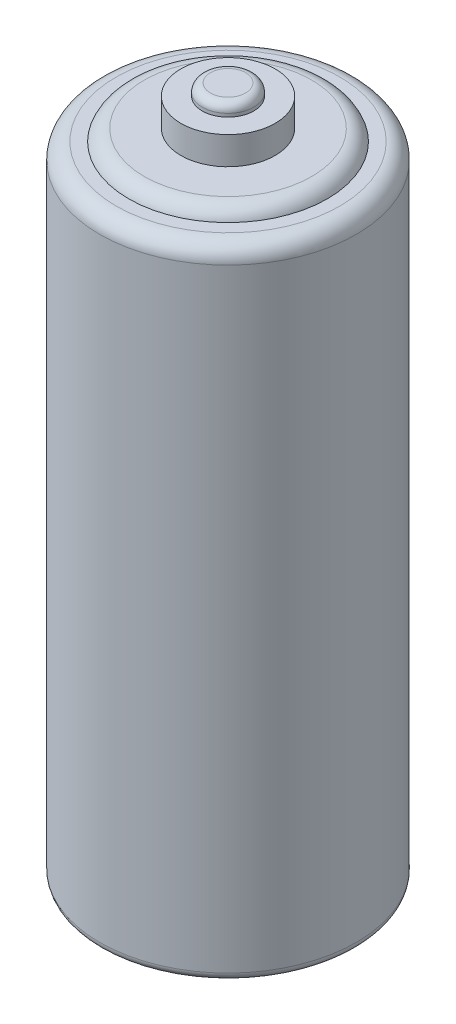
from build123d import *

# Parameters (mm, degrees)
SKETCH1_R            = 7.822299743
BOSS_EXTRUDE1_DEPTH  = 38.9
FILLET1_R            = 1
SKETCH7_R            = 6.058269956
BOSS_EXTRUDE7_DEPTH  = 0.7
FILLET5_R            = 1
SKETCH8_R            = 2.878199419
BOSS_EXTRUDE8_DEPTH  = 1.7
SKETCH9_R            = 1.57347679
BOSS_EXTRUDE9_DEPTH  = 0.7
FILLET7_R            = 0.5
SKETCH10_R           = 6.615584601
BOSS_EXTRUDE11_DEPTH = 0.2
FILLET8_R            = 0.5
FILLET9_R            = 0.5
SKETCH11_R           = 5.403530489
BOSS_EXTRUDE12_DEPTH = 0.2
FILLET10_R           = 0.5


with BuildPart() as part:
    # Sketch1 → Boss-Extrude1 (new body)
    with BuildSketch(Plane(origin=(0, 0, 0), x_dir=(1, 0, 0), z_dir=(0, 1, 0))):
        with Locations(Location((-7.367466469, 0.770235131, 0), (0, 0, 270))):
            Circle(SKETCH1_R)
    extrude(amount=BOSS_EXTRUDE1_DEPTH)

    # Fillet1
    fillet1_edges = [part.edges().sort_by_distance(p)[0] for p in [
        (-7.367466469, 38.9, -8.592534873),
    ]]
    fillet(fillet1_edges, radius=FILLET1_R)

    # Sketch7 → Boss-Extrude7 (add)
    with BuildSketch(Plane(origin=(0, 38.9, 0), x_dir=(1, 0, 0), z_dir=(0, 1, 0))):
        with Locations(Location((-7.367466469, 0.770235131, 0), (0, 0, 270))):
            Circle(SKETCH7_R)
    extrude(amount=BOSS_EXTRUDE7_DEPTH)

    # Fillet5
    # the kernel refuses this fillet: 1 mm, written as the material it takes off along each edge
    with BuildSketch(Plane(origin=(-7.367466469, 39.6, -0.770235131), x_dir=(0, 0, 1), z_dir=(-1, 0, 0))) as fillet5_piece_1:
        with BuildLine():
            CenterArc((5.104330755, -1), FILLET5_R, 17.457603124, 72.542396876)
            Line((5.104330755, 0), (5.104330755, 0.02))
            Line((5.104330755, 0.02), (6.058269956, 0.02))
            Line((6.058269956, 0.02), (6.078269956, 0))
            ThreePointArc((6.078269956, 0), (6.078269956, -0.35), (6.07734874, -0.694))
            Line((6.07734874, -0.694), (6.058269956, -0.7))
        make_face()
    revolve(axis=Axis((-7.367466469, 39.6, -0.770235131), (0, 1, 0)), mode=Mode.SUBTRACT)

    # Sketch8 → Boss-Extrude8 (add)
    with BuildSketch(Plane(origin=(0, 39.6, 0), x_dir=(1, 0, 0), z_dir=(0, 1, 0))):
        with Locations(Location((-7.367466469, 0.770235131, 0), (0, 0, 270))):
            Circle(SKETCH8_R)
    extrude(amount=BOSS_EXTRUDE8_DEPTH)

    # Sketch9 → Boss-Extrude9 (add)
    with BuildSketch(Plane(origin=(0, 41.3, 0), x_dir=(1, 0, 0), z_dir=(0, 1, 0))):
        with Locations(Location((-7.367466469, 0.770235131, 0), (0, 0, 270))):
            Circle(SKETCH9_R)
    extrude(amount=BOSS_EXTRUDE9_DEPTH)

    # Fillet7
    fillet7_edges = [part.edges().sort_by_distance(p)[0] for p in [
        (-7.367466469, 42, -2.343711921),
    ]]
    fillet(fillet7_edges, radius=FILLET7_R)

    # Sketch10 → Boss-Extrude11 (add)
    with BuildSketch(Plane.XZ):
        with Locations(Location((-7.367466469, -0.770235131, 0), (0, 0, 270))):
            Circle(SKETCH10_R)
    extrude(amount=BOSS_EXTRUDE11_DEPTH)

    # Fillet8
    fillet8_edges = [part.edges().sort_by_distance(p)[0] for p in [
        (-7.367466469, 0, -8.592534873),
    ]]
    fillet(fillet8_edges, radius=FILLET8_R)

    # Fillet9
    # the kernel refuses this fillet: 0.5 mm, written as the material it takes off along each edge
    with BuildSketch(Plane(origin=(-7.367466469, -0.2, -0.770235131), x_dir=(0, 0, -1), z_dir=(-1, 0, 0))) as fillet9_piece_1:
        with BuildLine():
            CenterArc((6.215584601, -0.5), FILLET9_R, 36.869897645, 53.130102355)
            Line((6.215584601, 0), (6.215584601, 0.01))
            Line((6.215584601, 0.01), (6.615584601, 0.01))
            Line((6.615584601, 0.01), (6.625584601, 0))
            ThreePointArc((6.625584601, 0), (6.625584601, -0.1), (6.623584601, -0.194))
            Line((6.623584601, -0.194), (6.615584601, -0.2))
        make_face()
    revolve(axis=Axis((-7.367466469, -0.2, -0.770235131), (0, -1, 0)), mode=Mode.SUBTRACT)

    # Sketch11 → Boss-Extrude12 (add)
    with BuildSketch(Plane.XZ.offset(0.2)):
        with Locations(Location((-7.367466469, -0.770235131, 0), (0, 0, 270))):
            Circle(SKETCH11_R)
    extrude(amount=BOSS_EXTRUDE12_DEPTH)

    # Fillet10
    # the kernel refuses this fillet: 0.5 mm, written as the material it takes off along each edge
    with BuildSketch(Plane(origin=(-7.367466469, -0.4, -0.770235131), x_dir=(0, 0, -1), z_dir=(-1, 0, 0))) as fillet10_piece_1:
        with BuildLine():
            CenterArc((5.003530489, -0.5), FILLET10_R, 36.869897645, 53.130102355)
            Line((5.003530489, 0), (5.003530489, 0.01))
            Line((5.003530489, 0.01), (5.403530489, 0.01))
            Line((5.403530489, 0.01), (5.413530489, 0))
            ThreePointArc((5.413530489, 0), (5.413530489, -0.1), (5.411530489, -0.194))
            Line((5.411530489, -0.194), (5.403530489, -0.2))
        make_face()
    revolve(axis=Axis((-7.367466469, -0.4, -0.770235131), (0, -1, 0)), mode=Mode.SUBTRACT)


solid = part.part
